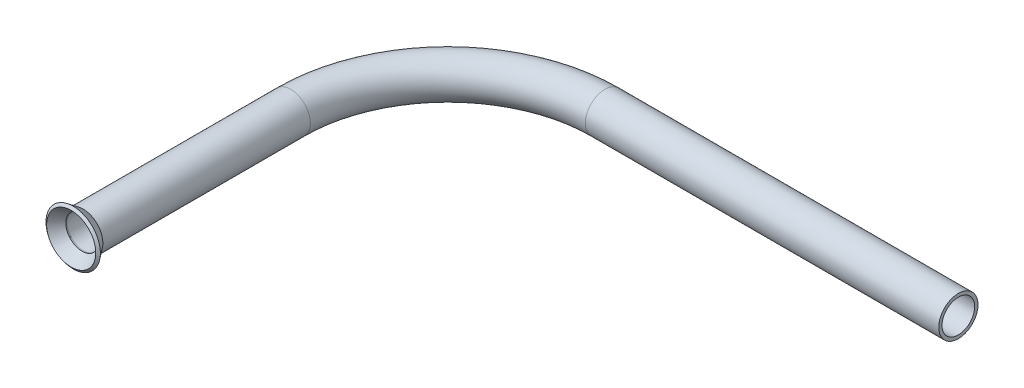
from build123d import *

# Parameters (mm, degrees)
SKETCH1_R                 = 6.35
SKETCH1_R_2               = 5.2832
PIPE_0_5_SCH_40_1_DEPTH   = 67.107863905
SKETCH1_ON_SEGMENT_2_R    = 6.35
SKETCH1_ON_SEGMENT_2_R_2  = 5.2832
PIPE_0_5_SCH_40_1_2_ANGLE = 90
SKETCH1_ON_SEGMENT_3_R    = 6.35
SKETCH1_ON_SEGMENT_3_R_2  = 5.2832
PIPE_0_5_SCH_40_1_3_DEPTH = 114.307049194


# Read off the part's stored shape, not the designer's step: Revolve1
with BuildPart() as part:
    # Revolve1 outline → Revolve1 (revolve)
    with BuildSketch(Plane.XZ):
        Polygon((5.2832, 0.356946287), (5.2832, 0), (6.35, 0), (8.795776254, 3.245654713), (7.943791892, 3.88767098), align=None)
    revolve(axis=Axis((0, 0, 0), (0, 0, 1)))


with BuildPart() as body_2:
    # Sketch1 → Pipe 0.5 SCH 40(1) (new body)
    with BuildSketch(Plane(origin=(0, 0, 0), x_dir=(-1, 0, 0), z_dir=(0, 0, -1))):
        Circle(SKETCH1_R)
        Circle(SKETCH1_R_2, mode=Mode.SUBTRACT)
    extrude(amount=PIPE_0_5_SCH_40_1_DEPTH)


with BuildPart() as body_3:
    # Sketch1 on segment 2 (carried to the start of arc 2) → Pipe 0.5 SCH 40_1 2 (revolve)
    with BuildSketch(Plane(origin=(0, 0, -67.107863905), x_dir=(-1, 0, 0), z_dir=(0, 0, -1))):
        Circle(SKETCH1_ON_SEGMENT_2_R)
        Circle(SKETCH1_ON_SEGMENT_2_R_2, mode=Mode.SUBTRACT)
    revolve(axis=Axis((50.8, 0, -67.107863905), (0, -1, 0)), revolution_arc=PIPE_0_5_SCH_40_1_2_ANGLE)


with BuildPart() as body_4:
    # Sketch1 on segment 3 (carried to segment 3) → Pipe 0.5 SCH 40_1 3 (new body)
    with BuildSketch(Plane(origin=(50.8, 0, -117.907863905), x_dir=(0, 0, -1), z_dir=(1, 0, 0))):
        Circle(SKETCH1_ON_SEGMENT_3_R)
        Circle(SKETCH1_ON_SEGMENT_3_R_2, mode=Mode.SUBTRACT)
    extrude(amount=PIPE_0_5_SCH_40_1_3_DEPTH)


with BuildPart() as body_2_1:
    add(body_2.part)

    # Pipe 0.5 SCH 40(1) as one body: union body 3, body 4
    add(body_3.part)
    add(body_4.part)


solid = Compound([part.part, body_2_1.part])
